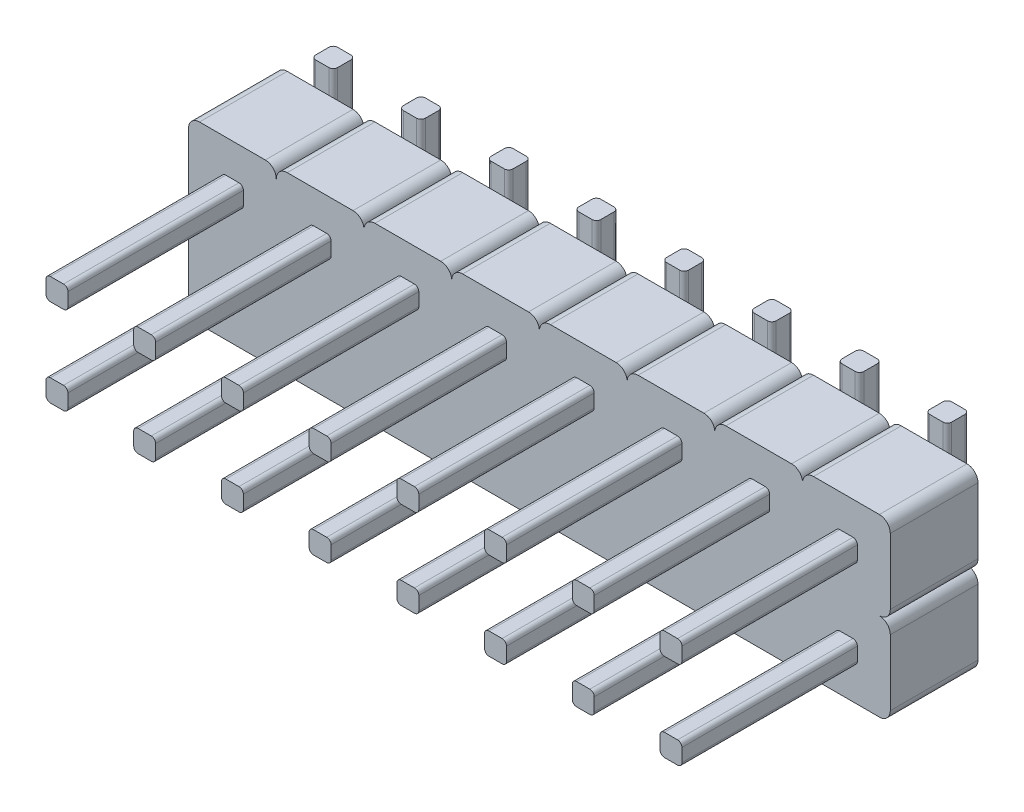
from build123d import *

# Parameters (mm, degrees)
EXTRUDE_1_DEPTH             = 2
EXTRUDE_START               = -2
EXTRUDE_2_DEPTH             = 6
PATTERN_LINEAR_2_COUNT      = 8
PATTERN_LINEAR_2_PITCH      = 2
PATTERN_LINEAR_2_COUNT_DIR2 = 2
PATTERN_LINEAR_2_PITCH_DIR2 = 2
PATTERN_LINEAR_10_COUNT     = 8
PATTERN_LINEAR_10_PITCH     = 2


with BuildPart() as part:
    # 草图1 → 凸台-拉伸1 (new body)
    with BuildSketch(Plane.XY):
        with BuildLine():
            Line((0.25, 0), (1.75, 0))
            ThreePointArc((1.75, 0), (1.926776695, -0.073223305), (2, -0.25))
            Line((2, -0.25), (2, -1.75))
            ThreePointArc((2, -1.75), (1.926776695, -1.926776695), (1.75, -2))
            Line((1.75, -2), (0.25, -2))
            ThreePointArc((0.25, -2), (0.073223305, -1.926776695), (0, -1.75))
            Line((0, -1.75), (0, -0.25))
            ThreePointArc((0, -0.25), (0.073223305, -0.073223305), (0.25, 0))
        make_face()
        with BuildLine():
            Line((0.85, -0.75), (1.15, -0.75))
            ThreePointArc((1.15, -0.75), (1.220710678, -0.779289322), (1.25, -0.85))
            Line((1.25, -0.85), (1.25, -1.15))
            ThreePointArc((1.25, -1.15), (1.220710678, -1.220710678), (1.15, -1.25))
            Line((1.15, -1.25), (0.85, -1.25))
            ThreePointArc((0.85, -1.25), (0.779289322, -1.220710678), (0.75, -1.15))
            Line((0.75, -1.15), (0.75, -0.85))
            ThreePointArc((0.75, -0.85), (0.779289322, -0.779289322), (0.85, -0.75))
        make_face(mode=Mode.SUBTRACT)
    extrude_1 = extrude(amount=EXTRUDE_1_DEPTH)

    # 草图2 → 凸台-拉伸2 (add)
    with BuildSketch(Plane.XY.offset(2).offset(EXTRUDE_START)):
        with BuildLine():
            Line((0.75, -0.85), (0.75, -1.15))
            ThreePointArc((0.75, -1.15), (0.779289322, -1.220710678), (0.85, -1.25))
            Line((0.85, -1.25), (1.15, -1.25))
            ThreePointArc((1.15, -1.25), (1.220710678, -1.220710678), (1.25, -1.15))
            Line((1.25, -1.15), (1.25, -0.85))
            ThreePointArc((1.25, -0.85), (1.220710678, -0.779289322), (1.15, -0.75))
            Line((1.15, -0.75), (0.85, -0.75))
            ThreePointArc((0.85, -0.75), (0.779289322, -0.779289322), (0.75, -0.85))
        make_face()
    extrude_2 = extrude(amount=EXTRUDE_2_DEPTH)

    # 阵列(线性)2: 凸台-拉伸1, Extrude 2 8 × 2
    with Locations(*[(i * PATTERN_LINEAR_2_PITCH, -j * PATTERN_LINEAR_2_PITCH_DIR2, 0) for i in range(PATTERN_LINEAR_2_COUNT) for j in range(PATTERN_LINEAR_2_COUNT_DIR2) if (i, j) != (0, 0)]):
        add(extrude_1)
        add(extrude_2)

    # 扫描2: sweep along a path in 草图4
    with BuildLine(Plane.ZY.offset(-1)) as sweep_2_path:
        Line((0, -1.250284889), (-0.45, -1.250284889))
        ThreePointArc((-0.45, -1.250284889), (-0.520710678, -1.220995567), (-0.55, -1.150284889))
        Line((-0.55, -1.150284889), (-0.55, 0.5))
    # 草图3 → 扫描2 (sweep)
    with BuildSketch(Plane(origin=(0, 0, 0), x_dir=(-1, 0, 0), z_dir=(0, 0, -1))):
        with BuildLine():
            Line((-0.75, -0.85), (-0.75, -1.15))
            ThreePointArc((-0.75, -1.15), (-0.779289322, -1.220710678), (-0.85, -1.25))
            Line((-0.85, -1.25), (-1.15, -1.25))
            ThreePointArc((-1.15, -1.25), (-1.220710678, -1.220710678), (-1.25, -1.15))
            Line((-1.25, -1.15), (-1.25, -0.85))
            ThreePointArc((-1.25, -0.85), (-1.220710678, -0.779289322), (-1.15, -0.75))
            Line((-1.15, -0.75), (-0.85, -0.75))
            ThreePointArc((-0.85, -0.75), (-0.779289322, -0.779289322), (-0.75, -0.85))
        make_face()
    sweep_2 = sweep(path=sweep_2_path.line)

    # 镜向5: 扫描2 across plane
    add(sweep_2.mirror(Plane(origin=(0, -2, 0), x_dir=(0, 0, 1), z_dir=(0, -1, 0))))

    # 阵列(线性)10: 扫描2 ×8
    with Locations(*[(i * PATTERN_LINEAR_10_PITCH, 0, 0) for i in range(1, PATTERN_LINEAR_10_COUNT)]):
        add(sweep_2)

    # 阵列(线性)10 copy 1: sweep along a path in 阵列(线性)10 copy 1 path
    with BuildLine(Plane(origin=(3, -4, 0), x_dir=(0, 0, 1), z_dir=(-1, 0, 0))) as pattern_linear_10_copy_1_path:
        Line((0, 1.250284889), (-0.45, 1.250284889))
        ThreePointArc((-0.45, 1.250284889), (-0.520710678, 1.220995567), (-0.55, 1.150284889))
        Line((-0.55, 1.150284889), (-0.55, -0.5))
    # 阵列(线性)10 copy 1 sketch → 阵列(线性)10 copy 1 (sweep)
    with BuildSketch(Plane(origin=(2, -4, 0), x_dir=(-1, 0, 0), z_dir=(0, 0, -1))):
        with BuildLine():
            Line((-0.75, 0.85), (-0.75, 1.15))
            ThreePointArc((-0.75, 1.15), (-0.779289322, 1.220710678), (-0.85, 1.25))
            Line((-0.85, 1.25), (-1.15, 1.25))
            ThreePointArc((-1.15, 1.25), (-1.220710678, 1.220710678), (-1.25, 1.15))
            Line((-1.25, 1.15), (-1.25, 0.85))
            ThreePointArc((-1.25, 0.85), (-1.220710678, 0.779289322), (-1.15, 0.75))
            Line((-1.15, 0.75), (-0.85, 0.75))
            ThreePointArc((-0.85, 0.75), (-0.779289322, 0.779289322), (-0.75, 0.85))
        make_face()
    sweep(path=pattern_linear_10_copy_1_path.line)

    # 阵列(线性)10 copy 2: sweep along a path in 阵列(线性)10 copy 2 path
    with BuildLine(Plane(origin=(5, -4, 0), x_dir=(0, 0, 1), z_dir=(-1, 0, 0))) as pattern_linear_10_copy_2_path:
        Line((0, 1.250284889), (-0.45, 1.250284889))
        ThreePointArc((-0.45, 1.250284889), (-0.520710678, 1.220995567), (-0.55, 1.150284889))
        Line((-0.55, 1.150284889), (-0.55, -0.5))
    # 阵列(线性)10 copy 2 sketch → 阵列(线性)10 copy 2 (sweep)
    with BuildSketch(Plane(origin=(4, -4, 0), x_dir=(-1, 0, 0), z_dir=(0, 0, -1))):
        with BuildLine():
            Line((-0.75, 0.85), (-0.75, 1.15))
            ThreePointArc((-0.75, 1.15), (-0.779289322, 1.220710678), (-0.85, 1.25))
            Line((-0.85, 1.25), (-1.15, 1.25))
            ThreePointArc((-1.15, 1.25), (-1.220710678, 1.220710678), (-1.25, 1.15))
            Line((-1.25, 1.15), (-1.25, 0.85))
            ThreePointArc((-1.25, 0.85), (-1.220710678, 0.779289322), (-1.15, 0.75))
            Line((-1.15, 0.75), (-0.85, 0.75))
            ThreePointArc((-0.85, 0.75), (-0.779289322, 0.779289322), (-0.75, 0.85))
        make_face()
    sweep(path=pattern_linear_10_copy_2_path.line)

    # 阵列(线性)10 copy 3: sweep along a path in 阵列(线性)10 copy 3 path
    with BuildLine(Plane(origin=(7, -4, 0), x_dir=(0, 0, 1), z_dir=(-1, 0, 0))) as pattern_linear_10_copy_3_path:
        Line((0, 1.250284889), (-0.45, 1.250284889))
        ThreePointArc((-0.45, 1.250284889), (-0.520710678, 1.220995567), (-0.55, 1.150284889))
        Line((-0.55, 1.150284889), (-0.55, -0.5))
    # 阵列(线性)10 copy 3 sketch → 阵列(线性)10 copy 3 (sweep)
    with BuildSketch(Plane(origin=(6, -4, 0), x_dir=(-1, 0, 0), z_dir=(0, 0, -1))):
        with BuildLine():
            Line((-0.75, 0.85), (-0.75, 1.15))
            ThreePointArc((-0.75, 1.15), (-0.779289322, 1.220710678), (-0.85, 1.25))
            Line((-0.85, 1.25), (-1.15, 1.25))
            ThreePointArc((-1.15, 1.25), (-1.220710678, 1.220710678), (-1.25, 1.15))
            Line((-1.25, 1.15), (-1.25, 0.85))
            ThreePointArc((-1.25, 0.85), (-1.220710678, 0.779289322), (-1.15, 0.75))
            Line((-1.15, 0.75), (-0.85, 0.75))
            ThreePointArc((-0.85, 0.75), (-0.779289322, 0.779289322), (-0.75, 0.85))
        make_face()
    sweep(path=pattern_linear_10_copy_3_path.line)

    # 阵列(线性)10 copy 4: sweep along a path in 阵列(线性)10 copy 4 path
    with BuildLine(Plane(origin=(9, -4, 0), x_dir=(0, 0, 1), z_dir=(-1, 0, 0))) as pattern_linear_10_copy_4_path:
        Line((0, 1.250284889), (-0.45, 1.250284889))
        ThreePointArc((-0.45, 1.250284889), (-0.520710678, 1.220995567), (-0.55, 1.150284889))
        Line((-0.55, 1.150284889), (-0.55, -0.5))
    # 阵列(线性)10 copy 4 sketch → 阵列(线性)10 copy 4 (sweep)
    with BuildSketch(Plane(origin=(8, -4, 0), x_dir=(-1, 0, 0), z_dir=(0, 0, -1))):
        with BuildLine():
            Line((-0.75, 0.85), (-0.75, 1.15))
            ThreePointArc((-0.75, 1.15), (-0.779289322, 1.220710678), (-0.85, 1.25))
            Line((-0.85, 1.25), (-1.15, 1.25))
            ThreePointArc((-1.15, 1.25), (-1.220710678, 1.220710678), (-1.25, 1.15))
            Line((-1.25, 1.15), (-1.25, 0.85))
            ThreePointArc((-1.25, 0.85), (-1.220710678, 0.779289322), (-1.15, 0.75))
            Line((-1.15, 0.75), (-0.85, 0.75))
            ThreePointArc((-0.85, 0.75), (-0.779289322, 0.779289322), (-0.75, 0.85))
        make_face()
    sweep(path=pattern_linear_10_copy_4_path.line)

    # 阵列(线性)10 copy 5: sweep along a path in 阵列(线性)10 copy 5 path
    with BuildLine(Plane(origin=(11, -4, 0), x_dir=(0, 0, 1), z_dir=(-1, 0, 0))) as pattern_linear_10_copy_5_path:
        Line((0, 1.250284889), (-0.45, 1.250284889))
        ThreePointArc((-0.45, 1.250284889), (-0.520710678, 1.220995567), (-0.55, 1.150284889))
        Line((-0.55, 1.150284889), (-0.55, -0.5))
    # 阵列(线性)10 copy 5 sketch → 阵列(线性)10 copy 5 (sweep)
    with BuildSketch(Plane(origin=(10, -4, 0), x_dir=(-1, 0, 0), z_dir=(0, 0, -1))):
        with BuildLine():
            Line((-0.75, 0.85), (-0.75, 1.15))
            ThreePointArc((-0.75, 1.15), (-0.779289322, 1.220710678), (-0.85, 1.25))
            Line((-0.85, 1.25), (-1.15, 1.25))
            ThreePointArc((-1.15, 1.25), (-1.220710678, 1.220710678), (-1.25, 1.15))
            Line((-1.25, 1.15), (-1.25, 0.85))
            ThreePointArc((-1.25, 0.85), (-1.220710678, 0.779289322), (-1.15, 0.75))
            Line((-1.15, 0.75), (-0.85, 0.75))
            ThreePointArc((-0.85, 0.75), (-0.779289322, 0.779289322), (-0.75, 0.85))
        make_face()
    sweep(path=pattern_linear_10_copy_5_path.line)

    # 阵列(线性)10 copy 6: sweep along a path in 阵列(线性)10 copy 6 path
    with BuildLine(Plane(origin=(13, -4, 0), x_dir=(0, 0, 1), z_dir=(-1, 0, 0))) as pattern_linear_10_copy_6_path:
        Line((0, 1.250284889), (-0.45, 1.250284889))
        ThreePointArc((-0.45, 1.250284889), (-0.520710678, 1.220995567), (-0.55, 1.150284889))
        Line((-0.55, 1.150284889), (-0.55, -0.5))
    # 阵列(线性)10 copy 6 sketch → 阵列(线性)10 copy 6 (sweep)
    with BuildSketch(Plane(origin=(12, -4, 0), x_dir=(-1, 0, 0), z_dir=(0, 0, -1))):
        with BuildLine():
            Line((-0.75, 0.85), (-0.75, 1.15))
            ThreePointArc((-0.75, 1.15), (-0.779289322, 1.220710678), (-0.85, 1.25))
            Line((-0.85, 1.25), (-1.15, 1.25))
            ThreePointArc((-1.15, 1.25), (-1.220710678, 1.220710678), (-1.25, 1.15))
            Line((-1.25, 1.15), (-1.25, 0.85))
            ThreePointArc((-1.25, 0.85), (-1.220710678, 0.779289322), (-1.15, 0.75))
            Line((-1.15, 0.75), (-0.85, 0.75))
            ThreePointArc((-0.85, 0.75), (-0.779289322, 0.779289322), (-0.75, 0.85))
        make_face()
    sweep(path=pattern_linear_10_copy_6_path.line)

    # 阵列(线性)10 copy 7: sweep along a path in 阵列(线性)10 copy 7 path
    with BuildLine(Plane(origin=(15, -4, 0), x_dir=(0, 0, 1), z_dir=(-1, 0, 0))) as pattern_linear_10_copy_7_path:
        Line((0, 1.250284889), (-0.45, 1.250284889))
        ThreePointArc((-0.45, 1.250284889), (-0.520710678, 1.220995567), (-0.55, 1.150284889))
        Line((-0.55, 1.150284889), (-0.55, -0.5))
    # 阵列(线性)10 copy 7 sketch → 阵列(线性)10 copy 7 (sweep)
    with BuildSketch(Plane(origin=(14, -4, 0), x_dir=(-1, 0, 0), z_dir=(0, 0, -1))):
        with BuildLine():
            Line((-0.75, 0.85), (-0.75, 1.15))
            ThreePointArc((-0.75, 1.15), (-0.779289322, 1.220710678), (-0.85, 1.25))
            Line((-0.85, 1.25), (-1.15, 1.25))
            ThreePointArc((-1.15, 1.25), (-1.220710678, 1.220710678), (-1.25, 1.15))
            Line((-1.25, 1.15), (-1.25, 0.85))
            ThreePointArc((-1.25, 0.85), (-1.220710678, 0.779289322), (-1.15, 0.75))
            Line((-1.15, 0.75), (-0.85, 0.75))
            ThreePointArc((-0.85, 0.75), (-0.779289322, 0.779289322), (-0.75, 0.85))
        make_face()
    sweep(path=pattern_linear_10_copy_7_path.line)


solid = part.part
